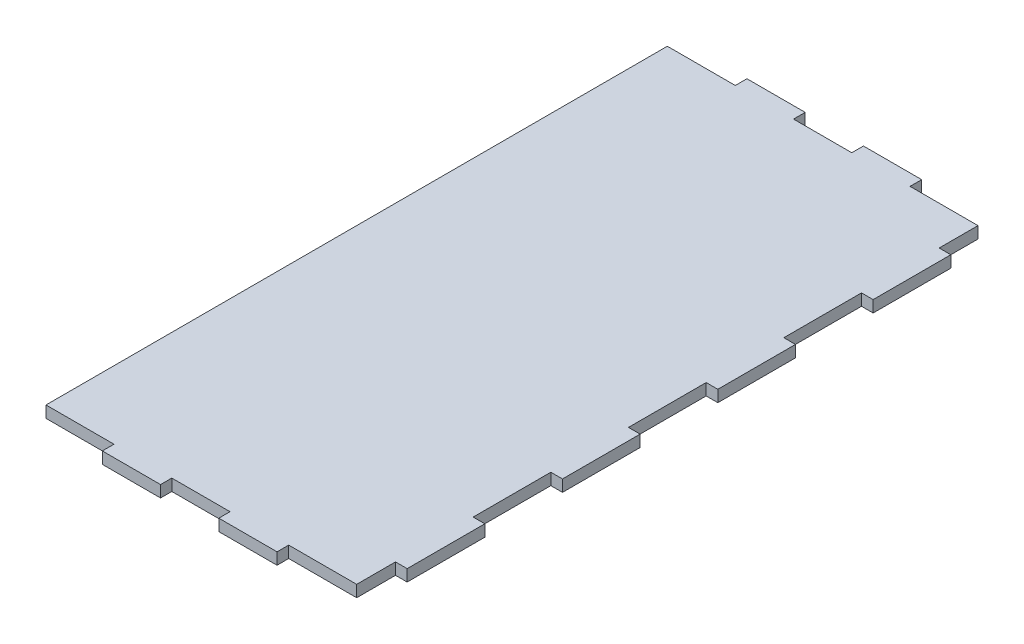
from build123d import *

# Parameters (mm, degrees)
SALIENTE_EXTRUIR1_DEPTH = 3


with BuildPart() as part:
    # Croquis1 → Saliente-Extruir1 (new body)
    with BuildSketch(Plane(origin=(0, 0, 0), x_dir=(1, 0, 0), z_dir=(0, 1, 0))):
        Polygon((23, 6), (23, 3), (38, 3), (38, 5.896935859), (53, 5.896935859), (53, 3), (68, 3), (68, 6), (85.5, 6), (85.5, 16), (88.5, 16), (88.5, 36), (85.5, 36), (85.5, 56), (88.5, 56), (88.5, 76), (85.5, 76), (85.5, 96), (88.5, 96), (88.5, 116), (85.5, 116), (85.5, 136), (88.5, 136), (88.5, 156), (85.5, 156), (85.5, 166), (68, 166), (68, 169), (53, 169), (53, 166), (45.5, 166), (38, 166), (38, 169), (23, 169), (23, 166), (5.5, 166), (5.5, 153), (5.5, 133), (5.5, 113), (5.5, 93), (5.5, 73), (5.5, 53), (5.5, 33), (5.5, 13), (5.5, 6), align=None)
    extrude(amount=SALIENTE_EXTRUIR1_DEPTH)


solid = part.part
